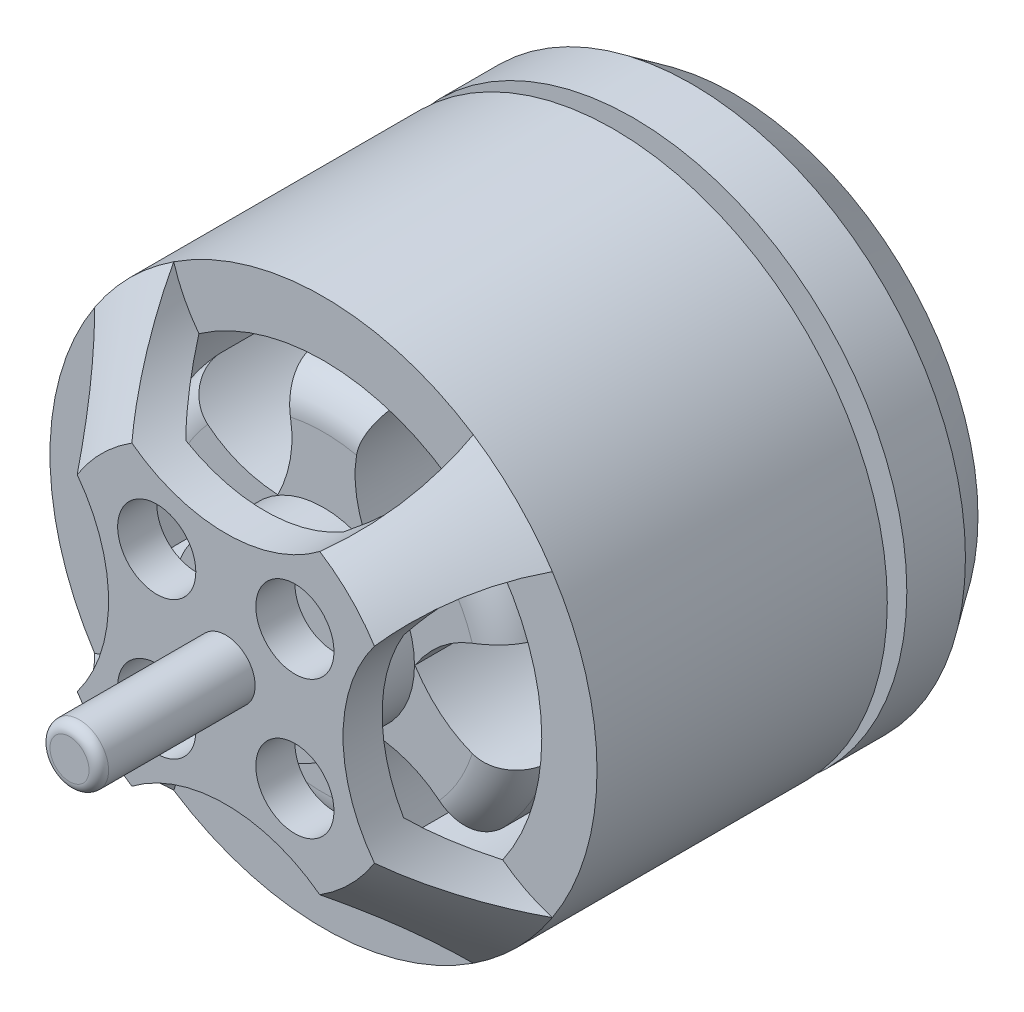
from build123d import *

# Parameters (mm, degrees)
CUT_EXTRUDE3_DEPTH  = 2.5
SKETCH3_R           = 4
CUT_EXTRUDE4_DEPTH  = 2.5
BOSS_EXTRUDE1_REACH = 18.741
SKETCH4_R           = 0.7499999999999999
SKETCH5_R           = 1
SKETCH5_R_2         = 1.0000000000000153
SKETCH5_R_3         = 1.0000000000000306
SKETCH5_R_4         = 1.0000000000000455
CUT_EXTRUDE5_DEPTH  = 2.5
SKETCH6_R           = 1.0000000000000004
SKETCH6_R_2         = 1.0000000000000002
SKETCH6_R_3         = 1
CUT_EXTRUDE6_DEPTH  = 2.5
SKETCH7_R           = 2.3284271247461894
BOSS_EXTRUDE4_DEPTH = 11
FILLET1_R           = 0.25
BOSS_EXTRUDE6_DEPTH = 9
CIRPATTERN1_COUNT   = 6
FILLET2_R           = 1


# Read off the part's stored shape, not the designer's step: Shell1, Shell2
with BuildPart() as part:
    # Sketch1 → Revolve1 (revolve)
    with BuildSketch(Plane(origin=(0, 0, 0), x_dir=(0, 0, -1), z_dir=(1, 0, 0)), mode=Mode.PRIVATE) as revolve1_sk:
        Polygon((0, 0.75), (0, 0), (13.928888994943424, 0), (13.928888994943424, 7), (6.500000000000007, 7), (4, 4.500000000000001), (4, 0.75), align=None)
        Polygon((14.428888994943426, 7), (14.428888994943426, 0), (18.500000000000004, 0), (18.500000000000004, 0.75), (17.5, 0.75), (17.5, 0.6), (17, 0.6), (17, 6.25), (15.92888899494342, 7), align=None)
    revolve(revolve1_sk.sketch.rotate(Axis((0, 0, 0), (0, 0, -1)), 90), axis=Axis((0, 0, 0), (0, 0, -1)))

    # Shell1 outline → Shell1 (revolve, cut)
    with BuildSketch(Plane.XZ):
        Polygon((0, -13.928888995), (6, -13.928888995), (6, -6.914213562), (4.085786438, -5), (0, -5), align=None)
    revolve(axis=Axis((0, 0, 0), (0, 0, 1)), mode=Mode.SUBTRACT)

    # Shell2 outline → Shell2 (revolve, cut)
    with BuildSketch(Plane.XZ):
        Polygon((5.729432949, -16), (6, -15.613590206), (6, -14.428888995), (0, -14.428888995), (0, -16), align=None)
    revolve(axis=Axis((0, 0, 0), (0, 0, 1)), mode=Mode.SUBTRACT)

    # Sketch2 → Cut-Extrude3 (cut)
    with BuildSketch(Plane.XY.offset(-17)):
        with BuildLine():
            Line((2, 1.5000000000000004), (4.582575694955839, 1.4999999999999998))
            ThreePointArc((4.582575694955839, 1.4999999999999998), (5.000905708222877, 1.7261387212474169), (5.0408332644514235, 2.2))
            ThreePointArc((5.0408332644514235, 2.2), (3.889087296526011, 3.8890872965260117), (2.1999999999999997, 5.040833264451424))
            ThreePointArc((2.1999999999999997, 5.040833264451424), (1.7261387212474162, 5.000905708222878), (1.4999999999999996, 4.58257569495584))
            Line((1.4999999999999996, 4.58257569495584), (1.5, 2.0000000000000004))
            ThreePointArc((1.5, 2.0000000000000004), (1.6464466094067263, 1.6464466094067267), (2, 1.5000000000000004))
        make_face()
        with BuildLine():
            ThreePointArc((-2, 1.5), (-1.6464466094067263, 1.6464466094067263), (-1.5, 2))
            Line((-1.5, 2), (-1.5000000000000004, 4.58257569495584))
            ThreePointArc((-1.5000000000000004, 4.58257569495584), (-1.7261387212474177, 5.000905708222877), (-2.2000000000000006, 5.0408332644514235))
            ThreePointArc((-2.2000000000000006, 5.0408332644514235), (-3.889087296526011, 3.8890872965260117), (-5.0408332644514235, 2.2))
            ThreePointArc((-5.0408332644514235, 2.2), (-5.000905708222876, 1.7261387212474169), (-4.582575694955839, 1.5))
            Line((-4.582575694955839, 1.5), (-2, 1.5))
        make_face()
        with BuildLine():
            ThreePointArc((-1.5, -2), (-1.646446609406726, -1.6464466094067265), (-1.9999999999999996, -1.5))
            Line((-1.9999999999999996, -1.5), (-4.582575694955839, -1.5))
            ThreePointArc((-4.582575694955839, -1.5), (-5.000905708222877, -1.7261387212474166), (-5.0408332644514235, -2.2))
            ThreePointArc((-5.0408332644514235, -2.2), (-3.889087296526011, -3.8890872965260117), (-2.2, -5.040833264451424))
            ThreePointArc((-2.2, -5.040833264451424), (-1.7261387212474162, -5.000905708222876), (-1.4999999999999996, -4.582575694955838))
            Line((-1.4999999999999996, -4.582575694955838), (-1.5, -2))
        make_face()
        with BuildLine():
            ThreePointArc((5.0408332644514235, -2.2), (5.000905708222877, -1.7261387212474166), (4.582575694955839, -1.5))
            Line((4.582575694955839, -1.5), (2.0000000000000004, -1.4999999999999996))
            ThreePointArc((2.0000000000000004, -1.4999999999999996), (1.6464466094067267, -1.6464466094067258), (1.5000000000000009, -1.9999999999999996))
            Line((1.5000000000000009, -1.9999999999999996), (1.5000000000000009, -4.582575694955838))
            ThreePointArc((1.5000000000000009, -4.582575694955838), (1.7261387212474175, -5.000905708222877), (2.200000000000002, -5.0408332644514235))
            ThreePointArc((2.200000000000002, -5.0408332644514235), (3.8890872965260117, -3.889087296526011), (5.0408332644514235, -2.2))
        make_face()
    extrude(amount=CUT_EXTRUDE3_DEPTH, mode=Mode.SUBTRACT)

    # Sketch3 → Cut-Extrude4 (cut)
    with BuildSketch(Plane.XY.offset(-4)):
        with Locations((0, 7)):
            Circle(SKETCH3_R)
        with Locations((7, 4.3e-16)):
            Circle(SKETCH3_R)
        with Locations((8.6e-16, -7)):
            Circle(SKETCH3_R)
        with Locations((-7, -1.29e-15)):
            Circle(SKETCH3_R)
    extrude(amount=-CUT_EXTRUDE4_DEPTH, mode=Mode.SUBTRACT)

    # Sketch4 → Boss-Extrude1 (add, up to next)
    with BuildSketch(Plane(origin=(0, 0, -5), x_dir=(-1, 0, 0), z_dir=(0, 0, -1)), mode=Mode.PRIVATE) as boss_extrude1_sk1:
        with Locations(Location((0, 0, 0), (0, 0, 180))):
            Circle(SKETCH4_R)
    boss_extrude1_tool1 = extrude(boss_extrude1_sk1.sketch, amount=BOSS_EXTRUDE1_REACH, mode=Mode.PRIVATE) - part.part
    add(boss_extrude1_tool1.solids().sort_by_distance((0, 0, -5))[0])

    # Sketch5 → Cut-Extrude5 (cut)
    with BuildSketch(Plane(origin=(0, 0, -17), x_dir=(-1, 0, 0), z_dir=(0, 0, -1))):
        with Locations((0, 4.5)):
            Circle(SKETCH5_R)
        with Locations((4.5, 2.8e-16)):
            Circle(SKETCH5_R_2)
        with Locations((5.5e-16, -4.5)):
            Circle(SKETCH5_R_3)
        with Locations((-4.5, -8.3e-16)):
            Circle(SKETCH5_R_4)
    extrude(amount=-CUT_EXTRUDE5_DEPTH, mode=Mode.SUBTRACT)

    # Sketch6 → Cut-Extrude6 (cut)
    with BuildSketch(Plane.XY.offset(-4)):
        with Locations((1.767766952966378, 1.7677669529663596)):
            Circle(SKETCH6_R)
        with Locations((1.7677669529663598, -1.7677669529663778)):
            Circle(SKETCH6_R)
        with Locations((-1.7677669529663778, -1.7677669529663598)):
            Circle(SKETCH6_R_2)
        with Locations((-1.76776695296636, 1.7677669529663775)):
            Circle(SKETCH6_R_3)
    extrude(amount=-CUT_EXTRUDE6_DEPTH, mode=Mode.SUBTRACT)

    # Sketch7 → Boss-Extrude4 (add)
    with BuildSketch(Plane.XY.offset(-16)):
        with Locations(Location((0, 0, 0), (0, 0, 201.438797872))):
            Circle(SKETCH7_R)
    extrude(amount=BOSS_EXTRUDE4_DEPTH)

    # Fillet1
    # the kernel refuses this fillet: 0.25 mm, written as the material it takes off along each edge
    with BuildSketch(Plane(origin=(0, 0, 0), x_dir=(1, 1.1e-16, 0), z_dir=(-1.1e-16, 1, 0))) as fillet1_piece_1:
        with BuildLine():
            CenterArc((0.75 - FILLET1_R, FILLET1_R), FILLET1_R, 270, 90)
            Line((0.75, FILLET1_R), (0.75 + FILLET1_R * 0.02, FILLET1_R))
            Line((0.75 + FILLET1_R * 0.02, FILLET1_R), (0.75 + FILLET1_R * 0.02, -FILLET1_R * 0.02))
            Line((0.75 + FILLET1_R * 0.02, -FILLET1_R * 0.02), (0.75 - FILLET1_R, -FILLET1_R * 0.02))
            Line((0.75 - FILLET1_R, -FILLET1_R * 0.02), (0.75 - FILLET1_R, 0))
        make_face()
    revolve(axis=Axis((0, 0, 0), (0, 0, -1)), mode=Mode.SUBTRACT)
    with BuildSketch(Plane(origin=(0, 0, -17.5), x_dir=(1, 1.1e-16, 0), z_dir=(-1.1e-16, 1, 0))) as fillet1_piece_2:
        with BuildLine():
            CenterArc((0.5, 0.22912878474778964), FILLET1_R, 293.5781784782019, 66.42182152179811)
            Line((0.75, 0.22912878474778964), (0.755, 0.22912878474778964))
            Line((0.755, 0.22912878474778964), (0.755, 0))
            Line((0.755, 0), (0.75, -0.00499999999999901))
            ThreePointArc((0.75, -0.00499999999999901), (0.6750000000000005, -0.00499999999999901), (0.6020000000000009, -0.00458257569496112))
            Line((0.6020000000000009, -0.00458257569496112), (0.6000000000000009, -3.55e-15))
        make_face()
    revolve(axis=Axis((0, 0, -17.5), (0, 0, -1)), mode=Mode.SUBTRACT)
    with BuildSketch(Plane(origin=(0, 0, -18.500000000000004), x_dir=(1, 1.1e-16, 0), z_dir=(-1.1e-16, 1, 0))) as fillet1_piece_3:
        with BuildLine():
            CenterArc((0.75 - FILLET1_R, -FILLET1_R), FILLET1_R, 0, 90)
            Line((0.75 - FILLET1_R, 0), (0.75 - FILLET1_R, FILLET1_R * 0.02))
            Line((0.75 - FILLET1_R, FILLET1_R * 0.02), (0.75 + FILLET1_R * 0.02, FILLET1_R * 0.02))
            Line((0.75 + FILLET1_R * 0.02, FILLET1_R * 0.02), (0.75 + FILLET1_R * 0.02, -FILLET1_R))
            Line((0.75 + FILLET1_R * 0.02, -FILLET1_R), (0.75, -FILLET1_R))
        make_face()
    revolve(axis=Axis((0, 0, -18.500000000000004), (0, 0, -1)), mode=Mode.SUBTRACT)

    # Sketch10 → Boss-Extrude6 (add)
    with BuildSketch(Plane.XY.offset(-6.500000000000001)):
        with BuildLine():
            Line((1.4e-16, 2.25), (3.1e-16, 5))
            ThreePointArc((7.136e-14, 5), (-0.5907182874877703, 4.9649825684313855), (-1.1731624000922383, 4.860420761930989))
            add(Edge.make_bspline(
                [(-1.1731624000922376, 4.860420761930947), (-0.40535827519651046, 3.4019991035433343), (-1.2499999999999996, 1.8708286933869707)],
                knots=[0.15192547945037874, 0.15192547945037874, 0.15192547945037874, 1, 1, 1], degree=2))
            ThreePointArc((-1.2499999999999996, 1.8708286933869709), (-0.6531215200402678, 2.153121520040216), (-8.38e-14, 2.25))
        make_face()
        with BuildLine():
            ThreePointArc((1.1731624000922378, 4.86042076193099), (0.5907182874878415, 4.964982568431377), (7.136e-14, 5))
            Line((3.1e-16, 5), (1.4e-16, 2.25))
            ThreePointArc((-8.38e-14, 2.25), (0.6531215200401879, 2.1531215200402403), (1.2500000000000002, 1.8708286933869704))
            add(Edge.make_bspline(
                [(1.1731624000922378, 4.860420761930947), (0.40535827519651096, 3.4019991035433343), (1.2500000000000004, 1.8708286933869709)],
                knots=[0.15192547945037874, 0.15192547945037874, 0.15192547945037874, 1, 1, 1], degree=2))
        make_face()
    boss_extrude6 = extrude(amount=-BOSS_EXTRUDE6_DEPTH)

    # CirPattern1: Boss-Extrude6 ×6 about axis
    cirpattern1_axis = Axis((0, 0, 0), (0, 0, 1))
    for i in range(1, CIRPATTERN1_COUNT):
        add(boss_extrude6.rotate(cirpattern1_axis, i * 360 / CIRPATTERN1_COUNT))

    # Fillet2
    fillet2_edges = [part.edges().sort_by_distance(p)[0] for p in [
        (-4.330127018922193, 2.5, -6.500000000000001),
        (-4.3301270189221945, 2.5000000000000004, -15.5),
        (-4.330127018922194, -2.4999999999999996, -6.500000000000001),
        (-4.330127018922195, -2.5000000000000004, -15.5),
        (-8e-17, -5, -6.500000000000001),
        (2.5e-16, -5.000000000000002, -15.5),
        (4.330127018922192, -2.5000000000000018, -6.500000000000001),
        (4.330127018922194, -2.500000000000002, -15.5),
        (4.330127018922193, 2.500000000000001, -6.500000000000001),
        (4.3301270189221945, 2.500000000000002, -15.5),
        (-8.6e-16, 5.000000000000002, -15.5),
        (-5.3e-16, 5, -6.500000000000001),
    ]]
    fillet(fillet2_edges, radius=FILLET2_R)


solid = part.part
